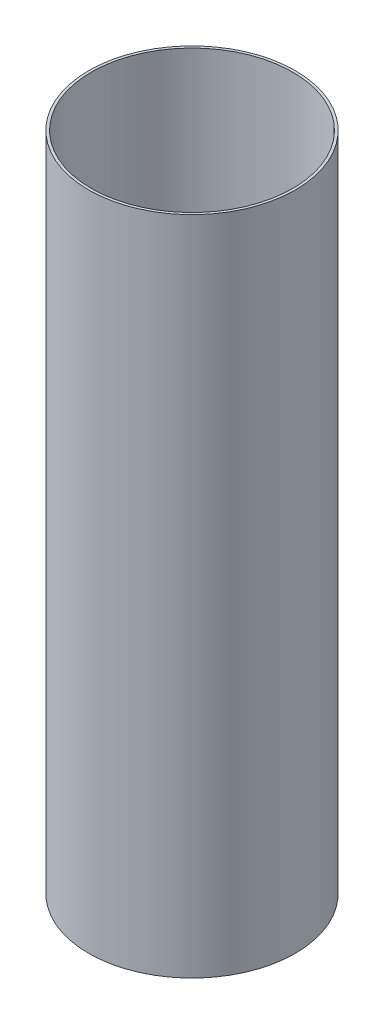
from build123d import *

# Parameters (mm, degrees)
SKETCH1_W = 1.96
SKETCH1_H = 500


with BuildPart() as part:
    # Sketch1 → Revolve1 (revolve)
    with BuildSketch(Plane.XY):
        with Locations((77.18, 250)):
            Rectangle(SKETCH1_W, SKETCH1_H)
    revolve(axis=Axis((0, 204.615384615, 0), (0, -1, 0)))


solid = part.part
